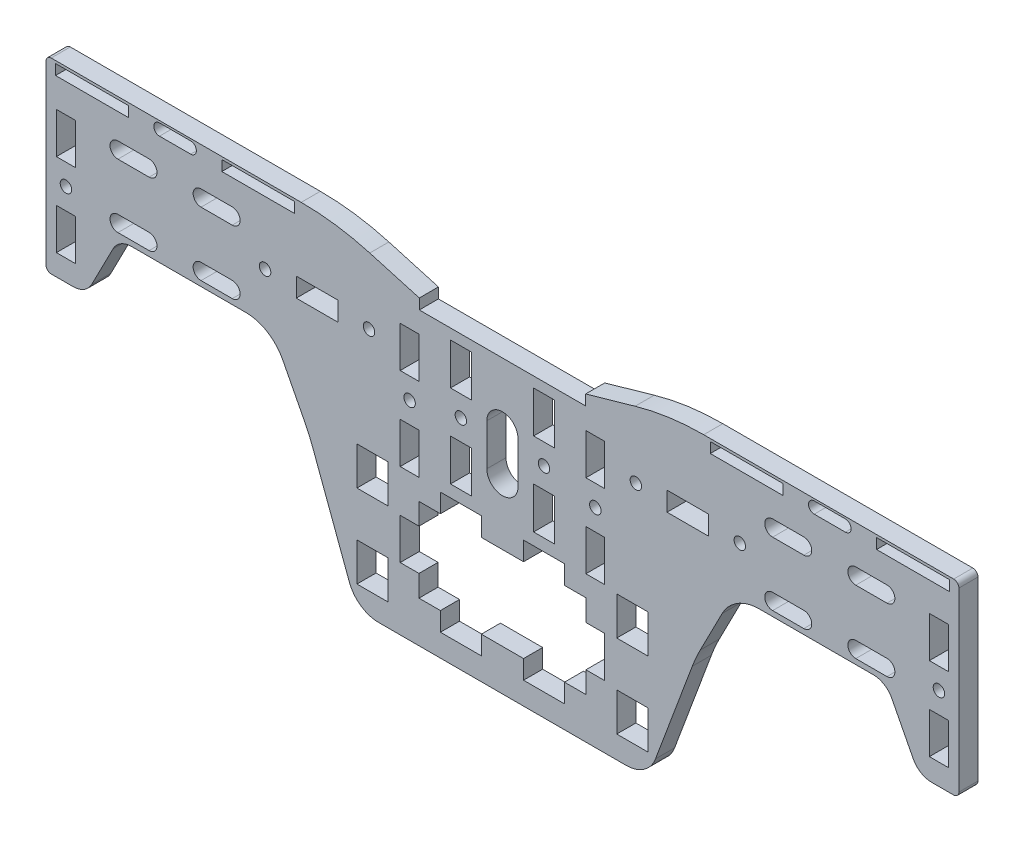
from build123d import *

# Parameters (mm, degrees)
SKETCH1_R           = 1.7526
SKETCH1_W           = 9.525
SKETCH1_H           = 11.684
SKETCH1_W_2         = 6.35
SKETCH1_H_2         = 12.7
SKETCH1_W_3         = 5.741999946
SKETCH1_H_3         = 12.5
SKETCH1_W_4         = 5.842
SKETCH1_W_5         = 12.7
SKETCH1_H_4         = 5.842
BOSS_EXTRUDE1_DEPTH = 5.842
FILLET1_R           = 12.7
FILLET2_R           = 9.525
FILLET4_R           = 76.2
FILLET5_R           = 50.8
FILLET6_R           = 6.35
FILLET7_R           = 1.5875
CUT_EXTRUDE2_DEPTH  = 158.941724336


with BuildPart() as part:
    # Sketch1 → Boss-Extrude1 (new body)
    with BuildSketch(Plane.XY):
        Polygon((25.4, 63.5), (-25.4, 63.5), (-25.4, 66.675), (-50.8, 73.9342438), (-139.446, 73.9342438), (-139.446, 16.7842438), (-127.254, 16.7842438), (-117.187573781, 36.3358938), (-70.673088246, 36.3358938), (-59.046135547, 13.75329052), (-44.45, -25.4), (44.45, -25.4), (59.046135547, 13.75329052), (70.673088246, 36.3358938), (117.187573781, 36.3358938), (127.254, 16.7842438), (139.446, 16.7842438), (139.446, 73.9342438), (50.8, 73.9342438), (25.4, 66.675), align=None)
        with Locations((28.370999973, 38.1)):
            Circle(SKETCH1_R, mode=Mode.SUBTRACT)
        with Locations((-28.370999973, 38.1)):
            Circle(SKETCH1_R, mode=Mode.SUBTRACT)
        with Locations((-12.7, 41.275)):
            Circle(SKETCH1_R, mode=Mode.SUBTRACT)
        with Locations((12.7, 41.275)):
            Circle(SKETCH1_R, mode=Mode.SUBTRACT)
        with Locations((-72.516999946, 50.7499874)):
            Circle(SKETCH1_R, mode=Mode.SUBTRACT)
        with Locations((-40.766999946, 50.7499874)):
            Circle(SKETCH1_R, mode=Mode.SUBTRACT)
        with Locations((40.766999946, 50.7499874)):
            Circle(SKETCH1_R, mode=Mode.SUBTRACT)
        with Locations((72.516999946, 50.7499874)):
            Circle(SKETCH1_R, mode=Mode.SUBTRACT)
        with Locations((133.35, 42.1842438)):
            Circle(SKETCH1_R, mode=Mode.SUBTRACT)
        with Locations((-133.35, 42.1842438)):
            Circle(SKETCH1_R, mode=Mode.SUBTRACT)
        Polygon((25.5, -12.8), (18.95, -12.8), (18.95, -18.542), (6.45, -18.542), (6.45, -12.8), (-6.45, -12.8), (-6.45, -18.542), (-18.95, -18.542), (-18.95, -12.8), (-25.5, -12.8), (-25.5, -6.25), (-31.241999946, -6.25), (-31.241999946, 6.25), (-25.5, 6.25), (-25.5, 12.8), (-18.95, 12.8), (-18.95, 18.542), (-6.45, 18.542), (-6.45, 12.8), (6.45, 12.8), (6.45, 18.542), (18.95, 18.542), (18.95, 12.8), (25.5, 12.8), (25.5, 6.25), (31.241999946, 6.25), (31.241999946, -6.25), (25.5, -6.25), align=None, mode=Mode.SUBTRACT)
        with Locations((39.6875, 12.7)):
            Rectangle(SKETCH1_W, SKETCH1_H, mode=Mode.SUBTRACT)
        with Locations((39.6875, -12.7)):
            Rectangle(SKETCH1_W, SKETCH1_H, mode=Mode.SUBTRACT)
        with Locations((-39.6875, -12.7)):
            Rectangle(SKETCH1_W, SKETCH1_H, mode=Mode.SUBTRACT)
        with Locations((-39.6875, 12.7)):
            Rectangle(SKETCH1_W, SKETCH1_H, mode=Mode.SUBTRACT)
        with Locations((-12.7, 28.575)):
            Rectangle(SKETCH1_W_2, SKETCH1_H_2, mode=Mode.SUBTRACT)
        with Locations((-12.7, 53.975)):
            Rectangle(SKETCH1_W_2, SKETCH1_H_2, mode=Mode.SUBTRACT)
        with BuildLine():
            Line((82.55, 62.1930938), (92.075, 62.1930938))
            ThreePointArc((92.075, 62.1930938), (94.488, 59.7800938), (92.075, 57.3670938))
            Line((92.075, 57.3670938), (82.55, 57.3670938))
            ThreePointArc((82.55, 57.3670938), (80.137, 59.7800938), (82.55, 62.1930938))
        make_face(mode=Mode.SUBTRACT)
        with BuildLine():
            Line((82.55, 42.7620938), (92.075, 42.7620938))
            ThreePointArc((92.075, 42.7620938), (94.488, 40.3490938), (92.075, 37.9360938))
            Line((92.075, 37.9360938), (82.55, 37.9360938))
            ThreePointArc((82.55, 37.9360938), (80.137, 40.3490938), (82.55, 42.7620938))
        make_face(mode=Mode.SUBTRACT)
        with BuildLine():
            Line((107.95, 62.1930938), (117.475, 62.1930938))
            ThreePointArc((117.475, 62.1930938), (119.888, 59.7800938), (117.475, 57.3670938))
            Line((117.475, 57.3670938), (107.95, 57.3670938))
            ThreePointArc((107.95, 57.3670938), (105.537, 59.7800938), (107.95, 62.1930938))
        make_face(mode=Mode.SUBTRACT)
        with BuildLine():
            Line((107.95, 42.7620938), (117.475, 42.7620938))
            ThreePointArc((117.475, 42.7620938), (119.888, 40.3490938), (117.475, 37.9360938))
            Line((117.475, 37.9360938), (107.95, 37.9360938))
            ThreePointArc((107.95, 37.9360938), (105.537, 40.3490938), (107.95, 42.7620938))
        make_face(mode=Mode.SUBTRACT)
        Polygon((63.5, 73.1404938), (76.2, 73.1404938), (85.725, 73.1404938), (85.725, 69.9654938), (76.2, 69.9654938), (63.5, 69.9654938), align=None, mode=Mode.SUBTRACT)
        Polygon((114.3, 73.1404938), (127, 73.1404938), (136.525, 73.1404938), (136.525, 69.9654938), (127, 69.9654938), (114.3, 69.9654938), align=None, mode=Mode.SUBTRACT)
        with Locations((-28.370999973, 50.8)):
            Rectangle(SKETCH1_W_3, SKETCH1_H_3, mode=Mode.SUBTRACT)
        with Locations((-28.370999973, 25.4)):
            Rectangle(SKETCH1_W_3, SKETCH1_H_3, mode=Mode.SUBTRACT)
        with Locations((28.370999973, 50.8)):
            Rectangle(SKETCH1_W_3, SKETCH1_H_3, mode=Mode.SUBTRACT)
        with Locations((28.370999973, 25.4)):
            Rectangle(SKETCH1_W_3, SKETCH1_H_3, mode=Mode.SUBTRACT)
        with Locations((133.35, 29.4842438)):
            Rectangle(SKETCH1_W_4, SKETCH1_H_3, mode=Mode.SUBTRACT)
        with Locations((133.35, 54.8842438)):
            Rectangle(SKETCH1_W_4, SKETCH1_H_3, mode=Mode.SUBTRACT)
        Polygon((-127, 69.9654938), (-136.525, 69.9654938), (-136.525, 73.1404938), (-127, 73.1404938), (-114.3, 73.1404938), (-114.3, 69.9654938), align=None, mode=Mode.SUBTRACT)
        Polygon((-85.725, 73.1404938), (-85.725, 69.9654938), (-76.2, 69.9654938), (-63.5, 69.9654938), (-63.5, 73.1404938), (-76.2, 73.1404938), align=None, mode=Mode.SUBTRACT)
        with BuildLine():
            Line((-107.95, 42.7620938), (-117.475, 42.7620938))
            ThreePointArc((-117.475, 42.7620938), (-119.888, 40.3490938), (-117.475, 37.9360938))
            Line((-117.475, 37.9360938), (-107.95, 37.9360938))
            ThreePointArc((-107.95, 37.9360938), (-105.537, 40.3490938), (-107.95, 42.7620938))
        make_face(mode=Mode.SUBTRACT)
        with BuildLine():
            Line((-107.95, 62.1930938), (-117.475, 62.1930938))
            ThreePointArc((-117.475, 62.1930938), (-119.888, 59.7800938), (-117.475, 57.3670938))
            Line((-117.475, 57.3670938), (-107.95, 57.3670938))
            ThreePointArc((-107.95, 57.3670938), (-105.537, 59.7800938), (-107.95, 62.1930938))
        make_face(mode=Mode.SUBTRACT)
        with BuildLine():
            Line((-82.55, 42.7620938), (-92.075, 42.7620938))
            ThreePointArc((-92.075, 42.7620938), (-94.488, 40.3490938), (-92.075, 37.9360938))
            Line((-92.075, 37.9360938), (-82.55, 37.9360938))
            ThreePointArc((-82.55, 37.9360938), (-80.137, 40.3490938), (-82.55, 42.7620938))
        make_face(mode=Mode.SUBTRACT)
        with BuildLine():
            Line((-82.55, 62.1930938), (-92.075, 62.1930938))
            ThreePointArc((-92.075, 62.1930938), (-94.488, 59.7800938), (-92.075, 57.3670938))
            Line((-92.075, 57.3670938), (-82.55, 57.3670938))
            ThreePointArc((-82.55, 57.3670938), (-80.137, 59.7800938), (-82.55, 62.1930938))
        make_face(mode=Mode.SUBTRACT)
        with Locations((12.7, 28.575)):
            Rectangle(SKETCH1_W_2, SKETCH1_H_2, mode=Mode.SUBTRACT)
        with Locations((12.7, 53.975)):
            Rectangle(SKETCH1_W_2, SKETCH1_H_2, mode=Mode.SUBTRACT)
        with BuildLine():
            Line((-95.25, 69.8003938), (-104.775, 69.8003938))
            ThreePointArc((-104.775, 69.8003938), (-106.5276, 71.5529938), (-104.775, 73.3055938))
            Line((-104.775, 73.3055938), (-95.25, 73.3055938))
            ThreePointArc((-95.25, 73.3055938), (-93.4974, 71.5529938), (-95.25, 69.8003938))
        make_face(mode=Mode.SUBTRACT)
        with Locations((56.641999946, 50.7499874)):
            Rectangle(SKETCH1_W_5, SKETCH1_H_4, mode=Mode.SUBTRACT)
        with Locations((-56.641999946, 50.7499874)):
            Rectangle(SKETCH1_W_5, SKETCH1_H_4, mode=Mode.SUBTRACT)
        with BuildLine():
            Line((95.25, 69.8003938), (104.775, 69.8003938))
            ThreePointArc((104.775, 69.8003938), (106.5276, 71.5529938), (104.775, 73.3055938))
            Line((104.775, 73.3055938), (95.25, 73.3055938))
            ThreePointArc((95.25, 73.3055938), (93.4974, 71.5529938), (95.25, 69.8003938))
        make_face(mode=Mode.SUBTRACT)
        with Locations((-133.35, 29.4842438)):
            Rectangle(SKETCH1_W_4, SKETCH1_H_3, mode=Mode.SUBTRACT)
        with Locations((-133.35, 54.8842438)):
            Rectangle(SKETCH1_W_4, SKETCH1_H_3, mode=Mode.SUBTRACT)
    extrude(amount=BOSS_EXTRUDE1_DEPTH)

    # Fillet1
    fillet1_edges = [part.edges().sort_by_distance(p)[0] for p in [
        (70.673088246, 36.3358938, 2.921),
        (-70.673088246, 36.3358938, 2.921),
    ]]
    fillet(fillet1_edges, radius=FILLET1_R)

    # Fillet2
    fillet2_edges = [part.edges().sort_by_distance(p)[0] for p in [
        (-44.45, -25.4, 2.921),
        (44.45, -25.4, 2.921),
    ]]
    fillet(fillet2_edges, radius=FILLET2_R)

    # Fillet4
    fillet4_edges = [part.edges().sort_by_distance(p)[0] for p in [
        (50.8, 73.9342438, 2.921),
        (-50.8, 73.9342438, 2.921),
    ]]
    fillet(fillet4_edges, radius=FILLET4_R)

    # Fillet5
    fillet5_edges = [part.edges().sort_by_distance(p)[0] for p in [
        (59.046135547, 13.75329052, 2.921),
        (-59.046135547, 13.75329052, 2.921),
    ]]
    fillet(fillet5_edges, radius=FILLET5_R)

    # Fillet6
    fillet6_edges = [part.edges().sort_by_distance(p)[0] for p in [
        (-127.254, 16.7842438, 2.921),
        (127.254, 16.7842438, 2.921),
        (117.187573781, 36.3358938, 2.921),
        (-117.187573781, 36.3358938, 2.921),
    ]]
    fillet(fillet6_edges, radius=FILLET6_R)

    # Fillet7
    fillet7_edges = [part.edges().sort_by_distance(p)[0] for p in [
        (139.446, 16.7842438, 2.921),
        (139.446, 73.9342438, 2.921),
        (-139.446, 73.9342438, 2.921),
        (-139.446, 16.7842438, 2.921),
    ]]
    fillet(fillet7_edges, radius=FILLET7_R)

    # Sketch5 → Cut-Extrude2 (cut, through all)
    with BuildSketch(Plane.XY.offset(5.842)):
        with BuildLine():
            Line((-4.7625, 31.8), (-4.7625, 44.5))
            ThreePointArc((-4.7625, 44.5), (0, 49.2625), (4.7625, 44.5))
            Line((4.7625, 44.5), (4.7625, 31.8))
            ThreePointArc((4.7625, 31.8), (0, 27.0375), (-4.7625, 31.8))
        make_face()
    extrude(amount=-CUT_EXTRUDE2_DEPTH, mode=Mode.SUBTRACT)


solid = part.part
